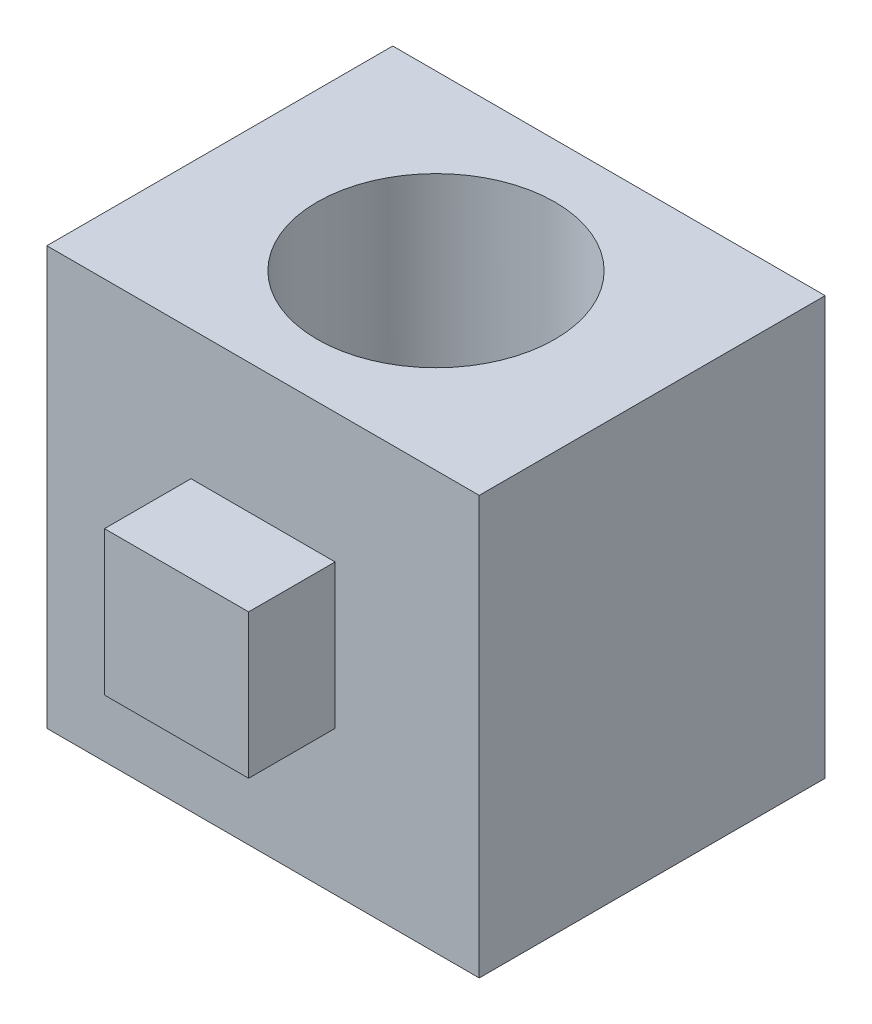
from build123d import *

# Parameters (mm, degrees)
SKETCH1_W           = 30
SKETCH1_H           = 29
BOSS_EXTRUDE1_DEPTH = 12
SKETCH2_R           = 8.25
CUT_EXTRUDE1_DEPTH  = 34
BOSS_EXTRUDE2_START = 12
SKETCH3_W           = 10
SKETCH3_H           = 10
BOSS_EXTRUDE2_DEPTH = 6


with BuildPart() as part:
    # Sketch1 → Boss-Extrude1 (new, symmetric)
    with BuildSketch(Plane.XY):
        with Locations((0, 14.5)):
            Rectangle(SKETCH1_W, SKETCH1_H)
    extrude(amount=BOSS_EXTRUDE1_DEPTH, both=True)

    # Sketch2 → Cut-Extrude1 (cut, symmetric)
    with BuildSketch(Plane(origin=(0, 0, 0), x_dir=(1, 0, 0), z_dir=(0, 1, 0))):
        Circle(SKETCH2_R)
    extrude(amount=CUT_EXTRUDE1_DEPTH, both=True, mode=Mode.SUBTRACT)

    # Sketch3 → Boss-Extrude2 (add)
    with BuildSketch(Plane.XY.offset(BOSS_EXTRUDE2_START)):
        with Locations((0, 15)):
            Rectangle(SKETCH3_W, SKETCH3_H)
    extrude(amount=BOSS_EXTRUDE2_DEPTH)


solid = part.part
